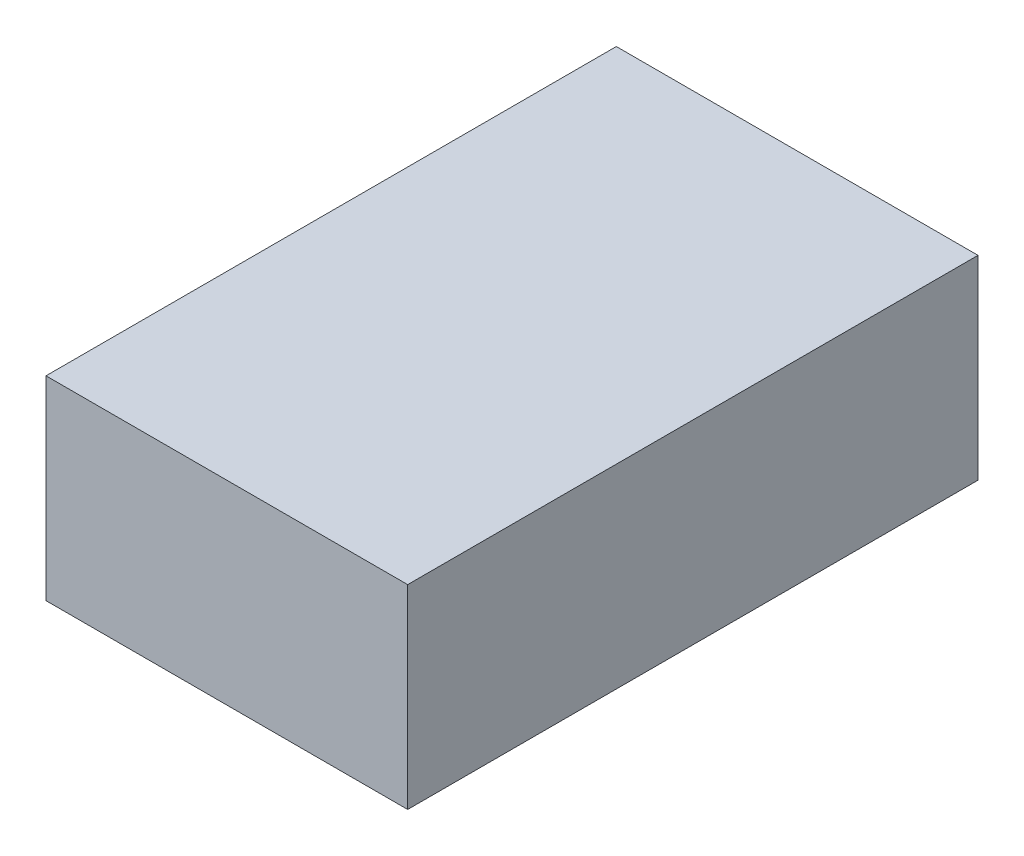
from build123d import *

# Parameters (mm, degrees)
SKETCH1_W           = 66.04
SKETCH1_H           = 104.14
BOSS_EXTRUDE1_DEPTH = 35.56


with BuildPart() as part:
    # Sketch1 → Boss-Extrude1 (new body)
    with BuildSketch(Plane(origin=(0, 0, 0), x_dir=(1, 0, 0), z_dir=(0, 1, 0))):
        Rectangle(SKETCH1_W, SKETCH1_H)
    extrude(amount=BOSS_EXTRUDE1_DEPTH)


solid = part.part
